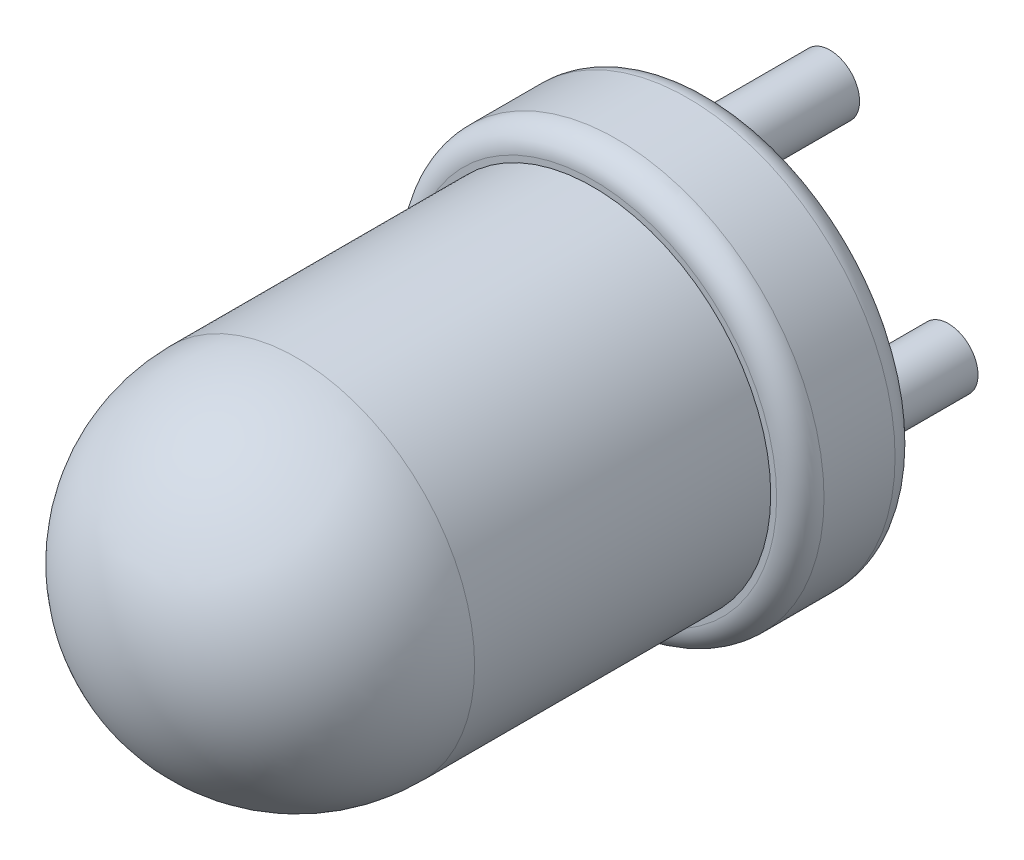
from build123d import *

# Parameters (mm, degrees)
SKETCH_1_R      = 1.5
EXTRUDE_1_DEPTH = 5
SKETCH_1_6_R    = 1.75
EXTRUDE_2_DEPTH = 1
SKETCH_1_7_R    = 0.25
EXTRUDE_3_DEPTH = 1
SKETCH_1_9_R    = 0.25
EXTRUDE_4_DEPTH = 2
FILLET_1_R      = 1.5
FILLET_2_R      = 0.2


with BuildPart() as part:
    # 草图1 → 凸台-拉伸1 (new body)
    with BuildSketch(Plane.XY):
        Circle(SKETCH_1_R)
    extrude(amount=EXTRUDE_1_DEPTH)

    # 草图1<6> → 凸台-拉伸2 (add)
    with BuildSketch(Plane.XY):
        Circle(SKETCH_1_6_R)
    extrude(amount=EXTRUDE_2_DEPTH)

    # 草图1<7> → 凸台-拉伸3 (add)
    with BuildSketch(Plane.XY):
        with Locations((0, 1.25)):
            Circle(SKETCH_1_7_R)
    extrude(amount=-EXTRUDE_3_DEPTH)

    # 草图1<9> → 凸台-拉伸4 (add)
    with BuildSketch(Plane.XY):
        with Locations((0, -1.25)):
            Circle(SKETCH_1_9_R)
    extrude(amount=-EXTRUDE_4_DEPTH)

    # 圆角1
    fillet_1_edges = [part.edges().sort_by_distance(p)[0] for p in [
        (-1.5, 0, 5),
    ]]
    fillet(fillet_1_edges, radius=FILLET_1_R)

    # 圆角2
    fillet_2_edges = [part.edges().sort_by_distance(p)[0] for p in [
        (-1.75, 0, 0),
        (-1.75, 0, 1),
    ]]
    fillet(fillet_2_edges, radius=FILLET_2_R)


solid = part.part
